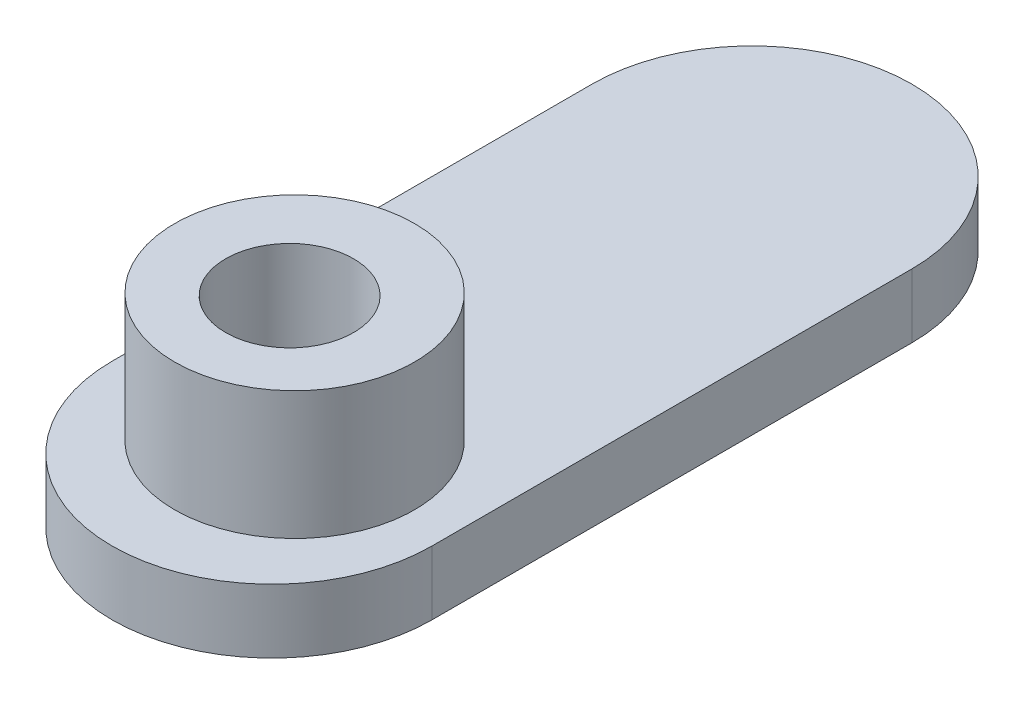
from build123d import *

# Parameters (mm, degrees)
BASE_DEPTH     = 20
SKETCH2_R      = 37.5
BOSS_DEPTH     = 40
SKETCH3_R      = 20
BOSSHOLE_DEPTH = 215.709105536


with BuildPart() as part:
    # Sketch1 → Base (new body)
    with BuildSketch(Plane(origin=(0, 0, 0), x_dir=(1, 0, 0), z_dir=(0, 1, 0))):
        with BuildLine():
            Line((50, 0), (50, 150))
            ThreePointArc((50, 150), (0, 200), (-50, 150))
            Line((-50, 150), (-50, 0))
            ThreePointArc((-50, 0), (0, -50), (50, 0))
        make_face()
    extrude(amount=BASE_DEPTH)

    # Sketch2 → Boss (add)
    with BuildSketch(Plane(origin=(0, 20, 0), x_dir=(1, 0, 0), z_dir=(0, 1, 0))):
        with Locations((0, 7.055875243)):
            Circle(SKETCH2_R)
    extrude(amount=BOSS_DEPTH)

    # Sketch3 → BossHole (cut, through all)
    with BuildSketch(Plane(origin=(0, 60, 0), x_dir=(1, 0, 0), z_dir=(0, 1, 0))):
        with Locations((0, 5.5)):
            Circle(SKETCH3_R)
    extrude(amount=-BOSSHOLE_DEPTH, mode=Mode.SUBTRACT)


solid = part.part
